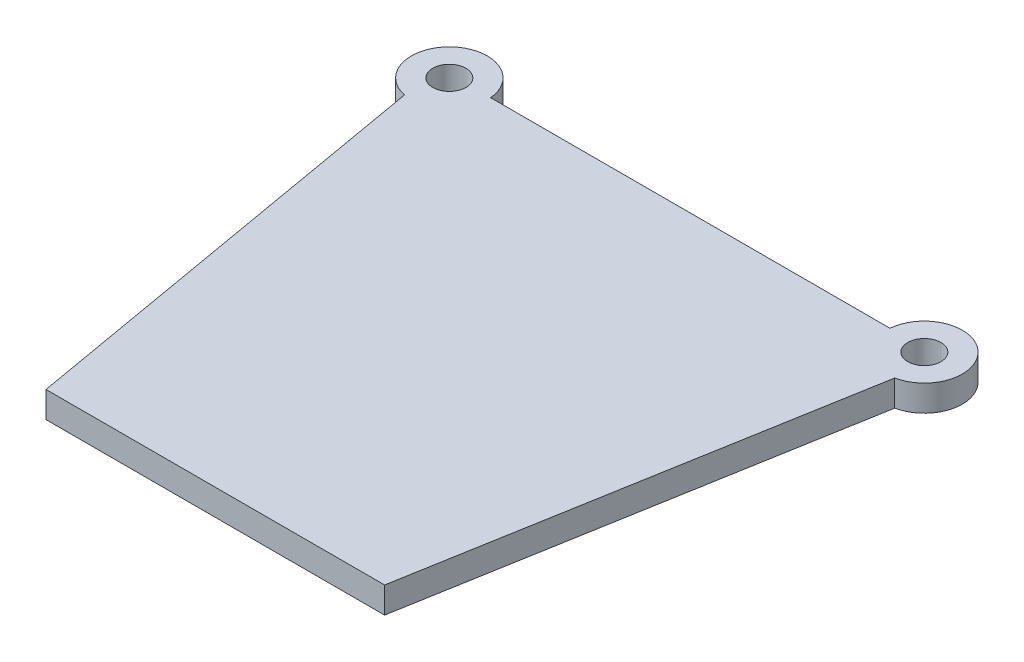
from build123d import *

# Parameters (mm, degrees)
SKETCH_1_R      = 3.5
EXTRUDE_1_DEPTH = 5.5


with BuildPart() as part:
    # ｽｹｯﾁ1 → ﾎﾞｽ - 押し出し1 (new body)
    with BuildSketch(Plane(origin=(0, 0, 0), x_dir=(1, 0, 0), z_dir=(0, 1, 0))):
        with BuildLine():
            Line((42.033253087, 35.661406239), (-42.033253087, 35.661406239))
            ThreePointArc((-42.033253087, 35.661406239), (-55.334528209, 40.894526452), (-51.606199967, 27.095648398))
            Line((-51.606199967, 27.095648398), (-35.643909231, -64.338593761))
            Line((-35.643909231, -64.338593761), (35.643909231, -64.338593761))
            Line((35.643909231, -64.338593761), (51.606199967, 27.095648398))
            ThreePointArc((51.606199967, 27.095648398), (55.334528209, 40.894526452), (42.033253087, 35.661406239))
        make_face()
        with Locations((-50, 34.932747457)):
            Circle(SKETCH_1_R, mode=Mode.SUBTRACT)
        with Locations((50, 34.932747457)):
            Circle(SKETCH_1_R, mode=Mode.SUBTRACT)
    extrude(amount=EXTRUDE_1_DEPTH)


solid = part.part
